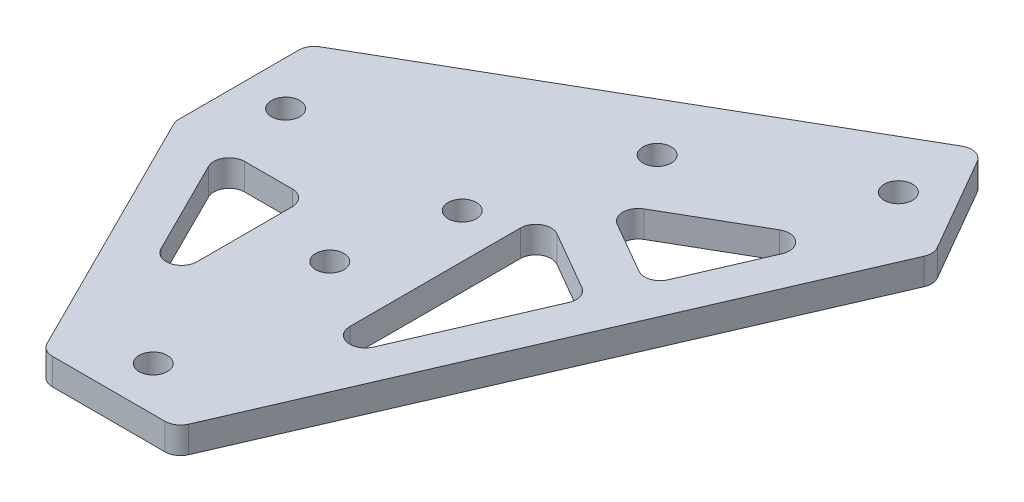
from build123d import *

# Parameters (mm, degrees)
SKETCH_4_R          = 1.6
EXTRUDE_1_DEPTH     = 1.5
CUT_EXTRUDE_2_DEPTH = 3
FILLET_2_R          = 1.75


with BuildPart() as part:
    # ｽｹｯﾁ4 → ﾎﾞｽ - 押し出し1 (new, symmetric)
    with BuildSketch(Plane(origin=(0, 0, 0), x_dir=(1, 0, 0), z_dir=(0, 1, 0))):
        Polygon((-30, 0), (-30, 15), (18.480762114, 42.990381057), (25.980762114, 30), (0, -30), (-15, -30), align=None)
        with Locations((0.580127019, 23.995190528)):
            Circle(SKETCH_4_R, mode=Mode.SUBTRACT)
        with Locations((-5, 7.5)):
            Circle(SKETCH_4_R, mode=Mode.SUBTRACT)
        with Locations((-7.5, -5)):
            Circle(SKETCH_4_R, mode=Mode.SUBTRACT)
        with Locations((-7.5, -25)):
            Circle(SKETCH_4_R, mode=Mode.SUBTRACT)
        with Locations((-25, 7.5)):
            Circle(SKETCH_4_R, mode=Mode.SUBTRACT)
        with Locations((17.900635095, 33.995190528)):
            Circle(SKETCH_4_R, mode=Mode.SUBTRACT)
    extrude(amount=EXTRUDE_1_DEPTH, both=True)

    # ｽｹｯﾁ5 → ｶｯﾄ - 押し出し2 (cut)
    with BuildSketch(Plane(origin=(0, 1.5, 0), x_dir=(1, 0, 0), z_dir=(0, 1, 0))):
        Polygon((-15, 0), (-24.968847051, 0), (-15, -19.937694101), align=None)
        Polygon((0, -18.675248347), (10.665448219, 5.955549254), (0, 12.113248654), align=None)
        Polygon((12.665448219, 10.574351407), (19.442413698, 26.225082782), (2.5, 16.443375673), align=None)
    extrude(amount=-CUT_EXTRUDE_2_DEPTH, mode=Mode.SUBTRACT)

    # ﾌｨﾚｯﾄ2
    fillet_2_edges = [part.edges().sort_by_distance(p)[0] for p in [
        (-15, 0, 19.937694101),
        (0, 0, 18.675248347),
        (10.665448219, 0, -5.955549254),
        (12.665448219, 0, -10.574351407),
        (2.5, 0, -16.443375673),
        (19.442413698, 0, -26.225082782),
        (-24.968847051, 0, 0),
        (-15, 0, 30),
        (0, 0, 30),
        (25.980762114, 0, -30),
        (18.480762114, 0, -42.990381057),
        (-30, 0, -15),
        (-30, 0, 0),
        (0, 0, -12.113248654),
        (-15, 0, 0),
    ]]
    fillet(fillet_2_edges, radius=FILLET_2_R)


solid = part.part
